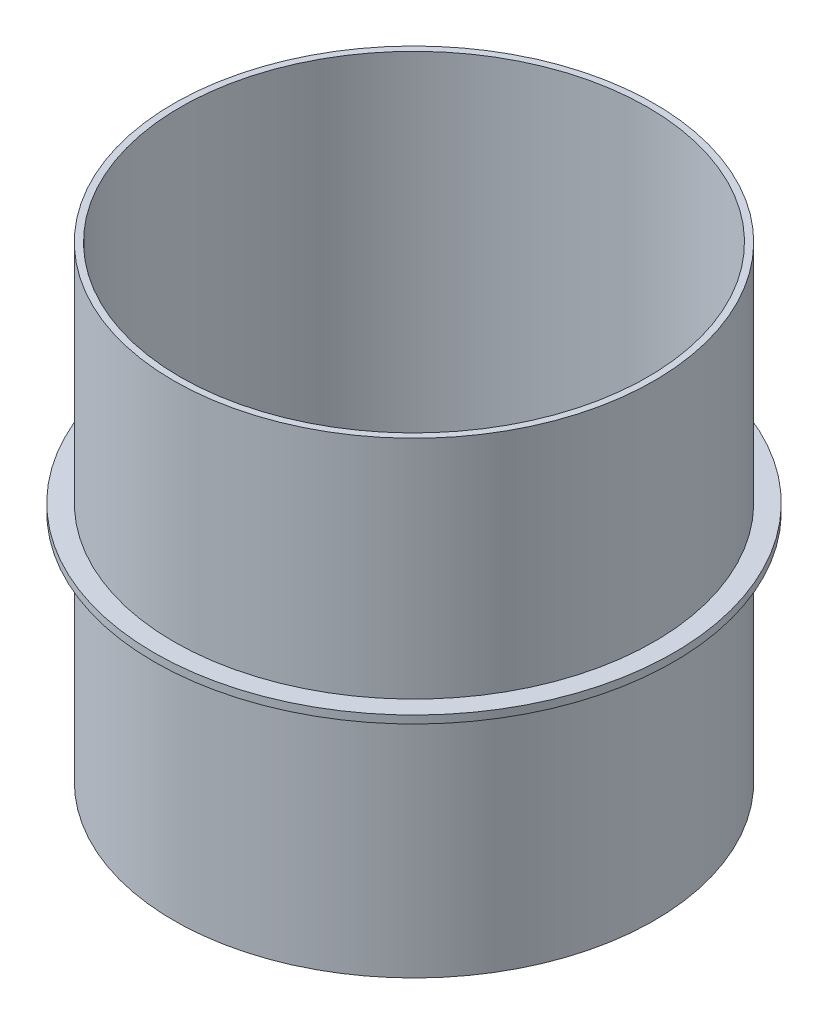
from build123d import *

# Parameters (mm, degrees)
SKETCH1_R           = 92.5
SKETCH1_R_2         = 90
BOSS_EXTRUDE1_DEPTH = 90
SKETCH2_R           = 100
SKETCH2_R_2         = 90
BOSS_EXTRUDE2_DEPTH = 3
MIRROR1_START       = 93
MIRROR1_OUTLINE_R   = 92.5
MIRROR1_OUTLINE_R_2 = 90
MIRROR1_DEPTH       = 87


# Read off the part's stored shape, not the designer's step: Mirror1
with BuildPart() as part:
    # Sketch1 → Boss-Extrude1 (new body)
    with BuildSketch(Plane(origin=(0, 0, 0), x_dir=(1, 0, 0), z_dir=(0, 1, 0))):
        with Locations(Location((0, 0, 0), (0, 0, 90))):
            Circle(SKETCH1_R)
        with Locations(Location((0, 0, 0), (0, 0, 90))):
            Circle(SKETCH1_R_2, mode=Mode.SUBTRACT)
    extrude(amount=BOSS_EXTRUDE1_DEPTH)

    # Sketch2 → Boss-Extrude2 (add)
    with BuildSketch(Plane(origin=(0, 90, 0), x_dir=(1, 0, 0), z_dir=(0, 1, 0))):
        with Locations(Location((0, 0, 0), (0, 0, 270))):
            Circle(SKETCH2_R)
        with Locations(Location((0, 0, 0), (0, 0, 90))):
            Circle(SKETCH2_R_2, mode=Mode.SUBTRACT)
    extrude(amount=BOSS_EXTRUDE2_DEPTH)

    # Mirror1 outline → Mirror1 (add)
    with BuildSketch(Plane(origin=(0, 0, 0), x_dir=(1, 0, 0), z_dir=(0, 1, 0)).offset(MIRROR1_START)):
        Circle(MIRROR1_OUTLINE_R)
        Circle(MIRROR1_OUTLINE_R_2, mode=Mode.SUBTRACT)
    extrude(amount=MIRROR1_DEPTH)


solid = part.part
